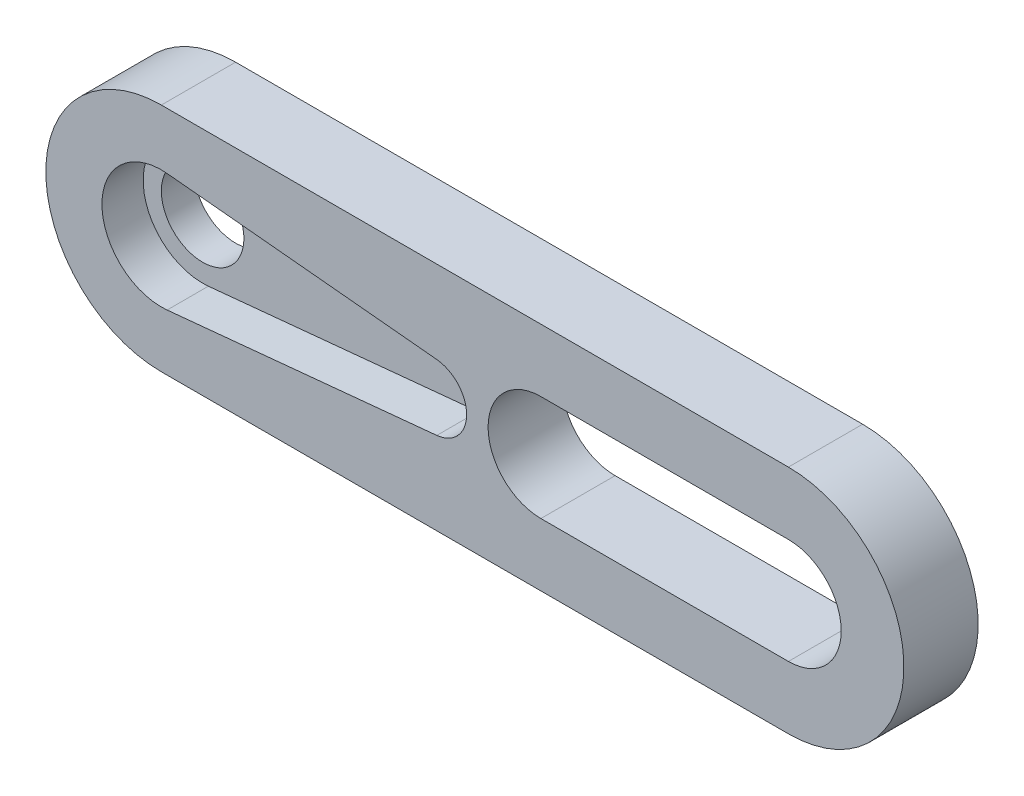
from build123d import *

# Parameters (mm, degrees)
MAIN_DEPTH            = 2.5
ORIGINALBRACKET_START = 2
ESQUISSE2_R           = 2.5
ORIGINALBRACKET_DEPTH = 2
CUT_EXTRUDE1_DEPTH    = 46.609757728


with BuildPart() as part:
    # Esquisse1 → Main (new body)
    with BuildSketch(Plane.XY):
        with BuildLine():
            Line((0, 7), (38, 7))
            ThreePointArc((38, 7), (45, 0), (38, -7))
            Line((38, -7), (0, -7))
            ThreePointArc((0, -7), (-7, 0), (0, 7))
        make_face()
        with BuildLine():
            Line((0.349090909, 3.583034404), (16.693939394, 1.990574669))
            ThreePointArc((16.693939394, 1.990574669), (18.5, 0), (16.693939394, -1.990574669))
            Line((16.693939394, -1.990574669), (0.349090909, -3.583034404))
            ThreePointArc((0.349090909, -3.583034404), (-3.6, 0), (0.349090909, 3.583034404))
        make_face(mode=Mode.SUBTRACT)
        with BuildLine():
            Line((23, 3.2), (38, 3.2))
            ThreePointArc((38, 3.2), (41.2, 0), (38, -3.2))
            Line((38, -3.2), (23, -3.2))
            ThreePointArc((23, -3.2), (19.8, 0), (23, 3.2))
        make_face(mode=Mode.SUBTRACT)
    extrude(amount=MAIN_DEPTH)

    # Esquisse2 → OriginalBracket (add)
    with BuildSketch(Plane(origin=(0, 0, 0), x_dir=(-1, 0, 0), z_dir=(0, 0, -1)).offset(ORIGINALBRACKET_START)):
        with BuildLine():
            Line((0, -7), (-38, -7))
            ThreePointArc((-38, -7), (-45, 0), (-38, 7))
            Line((-38, 7), (0, 7))
            ThreePointArc((0, 7), (7, 0), (0, -7))
        make_face()
        Circle(ESQUISSE2_R, mode=Mode.SUBTRACT)
    extrude(amount=-ORIGINALBRACKET_DEPTH)

    # Sketch1 → Cut-Extrude1 (cut, through all)
    with BuildSketch(Plane.XY):
        with BuildLine():
            Line((23, 3.2), (38, 3.2))
            ThreePointArc((38, 3.2), (41.2, 0), (38, -3.2))
            Line((38, -3.2), (23, -3.2))
            ThreePointArc((23, -3.2), (19.8, 0), (23, 3.2))
        make_face()
    extrude(amount=-CUT_EXTRUDE1_DEPTH, mode=Mode.SUBTRACT)


solid = part.part
